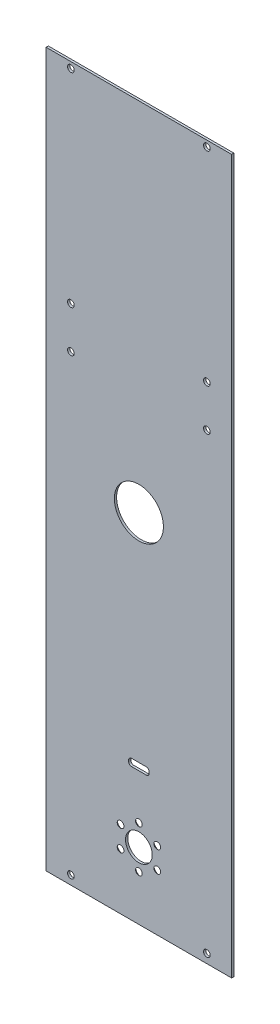
from build123d import *

# Parameters (mm, degrees)
SKETCH1_W                            = 83.2
SKETCH1_H                            = 320
BOSS_EXTRUDE1_DEPTH                  = 1
F_3_0_3_DIAMETER_HOLE1_D             = 3
SKETCH_1_R                           = 11
CUT_EXTRUDE_1_DEPTH                  = 166.322593737
SKETCH_2_R                           = 6
CUT_EXTRUDE_2_DEPTH                  = 10
SKETCH_3_R                           = 1.5
CUT_EXTRUDE_3_DEPTH                  = 10
CHAMFER_1_SIZE                       = 1
PATTERN_CIRCULAR_1_COUNT             = 6
CHAMFER_1_OF_PATTERN_CIRCULAR_1_SIZE = 1
CUT_EXTRUDE_4_DEPTH                  = 10


with BuildPart() as part:
    # Sketch1 → Boss-Extrude1 (new body)
    with BuildSketch(Plane.XY):
        Rectangle(SKETCH1_W, SKETCH1_H)
    extrude(amount=BOSS_EXTRUDE1_DEPTH)

    # Ø3.0 (3) Diameter Hole1 (through all)
    with Locations(Plane.XY.offset(1)):
        with Locations((-30.5, 66), (30.5, 66), (30.5, -156), (-30.5, -156), (-30.5, 157.3), (30.5, 157.3), (-30.5, 47.3), (30.5, 47.3)):
            Hole(F_3_0_3_DIAMETER_HOLE1_D / 2)

    # Эскиз1 → Вырез-Вытянуть1 (cut, through all)
    with BuildSketch(Plane.XY.offset(1)):
        Circle(SKETCH_1_R)
    extrude(amount=-CUT_EXTRUDE_1_DEPTH, mode=Mode.SUBTRACT)

    # Эскиз2 → Вырез-Вытянуть2 (cut)
    with BuildSketch(Plane.XY.offset(1)):
        with Locations((0, -130)):
            Circle(SKETCH_2_R)
    extrude(amount=-CUT_EXTRUDE_2_DEPTH, mode=Mode.SUBTRACT)

    # Эскиз3 → Вырез-Вытянуть3 (cut)
    with BuildSketch(Plane.XY.offset(1)):
        with Locations((0, -120.5)):
            Circle(SKETCH_3_R)
    cut_extrude_3 = extrude(amount=-CUT_EXTRUDE_3_DEPTH, mode=Mode.SUBTRACT)

    # Фаска1
    chamfer_1_edges = [part.edges().sort_by_distance(p)[0] for p in [
        (-1.5, -120.5, 0),
    ]]
    chamfer(chamfer_1_edges, length=CHAMFER_1_SIZE - 0.0001)  # a hair under: the kernel refuses the full size

    # Круговой массив1: Вырез-Вытянуть3 ×6 about axis
    pattern_circular_1_axis = Axis((0, -130, 0), (0, 0, 1))
    for i in range(1, PATTERN_CIRCULAR_1_COUNT):
        add(cut_extrude_3.rotate(pattern_circular_1_axis, i * 360 / PATTERN_CIRCULAR_1_COUNT), mode=Mode.SUBTRACT)

    # Фаска1 of Круговой массив1
    chamfer_1_of_pattern_circular_1_edges = [part.edges().sort_by_distance(p)[0] for p in [
        (-8.977241336, -126.549038106, 0),
        (-7.477241336, -136.049038106, 0),
        (1.5, -139.5, 0),
        (8.977241336, -133.450961894, 0),
        (7.477241336, -123.950961894, 0),
    ]]
    chamfer(chamfer_1_of_pattern_circular_1_edges, length=CHAMFER_1_OF_PATTERN_CIRCULAR_1_SIZE - 0.0001)  # a hair under: the kernel refuses the full size

    # Эскиз4 → Вырез-Вытянуть4 (cut)
    with BuildSketch(Plane(origin=(0, 0, 0), x_dir=(-1, 0, 0), z_dir=(0, 0, -1))):
        with BuildLine():
            Line((-3.3, -100.29662602), (3.3, -100.29662602))
            ThreePointArc((3.3, -100.29662602), (4.219238816, -99.915864836), (4.6, -98.99662602))
            Line((4.6, -98.99662602), (4.6, -98.39662602))
            ThreePointArc((4.6, -98.39662602), (4.219238816, -97.477387205), (3.3, -97.09662602))
            Line((3.3, -97.09662602), (-3.3, -97.09662602))
            ThreePointArc((-3.3, -97.09662602), (-4.219238816, -97.477387205), (-4.6, -98.39662602))
            Line((-4.6, -98.39662602), (-4.6, -98.99662602))
            ThreePointArc((-4.6, -98.99662602), (-4.219238816, -99.915864836), (-3.3, -100.29662602))
        make_face()
    extrude(amount=-CUT_EXTRUDE_4_DEPTH, mode=Mode.SUBTRACT)


solid = part.part
